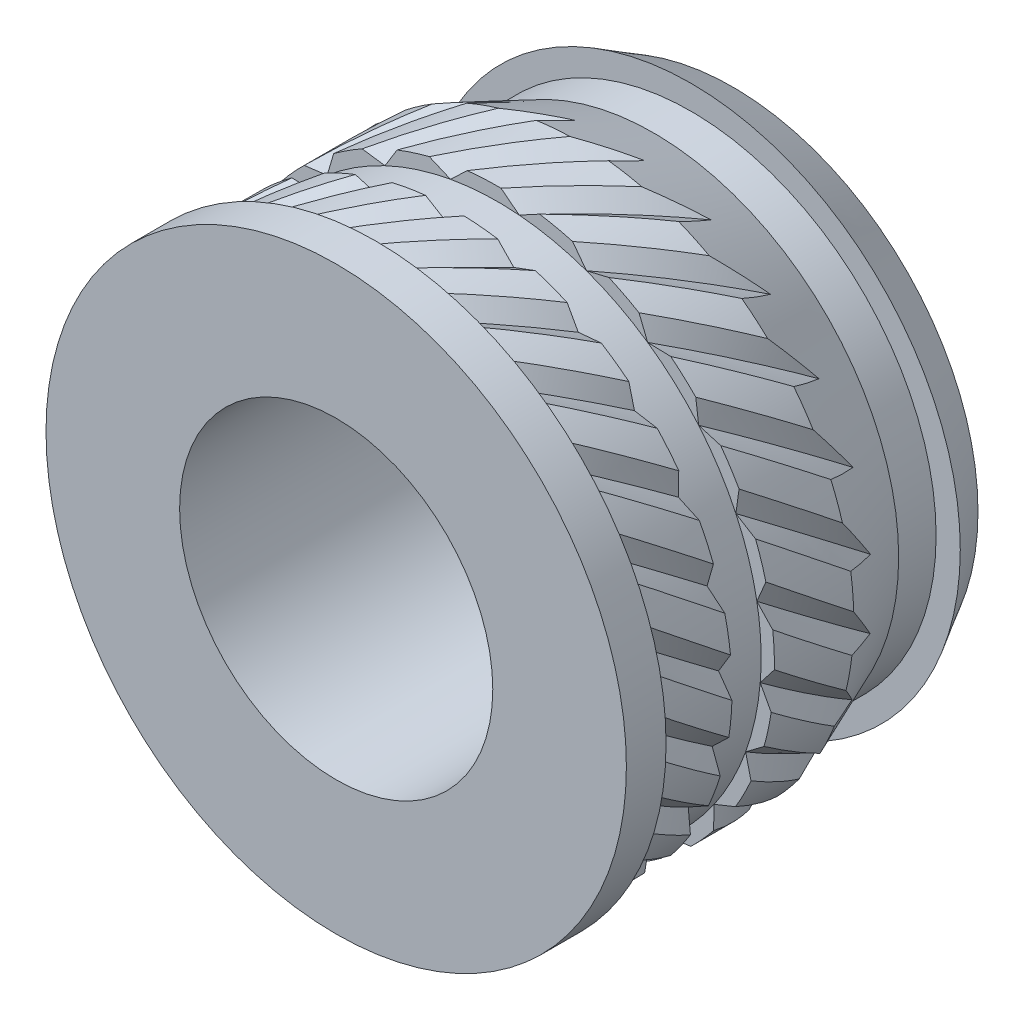
from build123d import *

# Parameters (mm, degrees)
CUT_SWEEP1_PITCH  = 21.28
CIRPATTERN1_COUNT = 24


with BuildPart() as part:
    # Sketch3 → Revolve1 (revolve)
    with BuildSketch(Plane(origin=(0, 0, 0), x_dir=(0, 0, -1), z_dir=(1, 0, 0)), mode=Mode.PRIVATE) as revolve1_sk:
        Polygon((-1.9, 1.5), (-1.9, 2.78), (-1.52, 2.78), (-1.52, 2.6525), (-0.76, 2.6525), (-0.76, 2.525), (-0.354524476, 2.525), (-0.354524476, 2.6525), (0.405475524, 2.6525), (1.14, 2.34825), (1.498597225, 2.34825), (1.498597225, 2.58), (1.9, 2.34825), (1.9, 1.5), align=None)
    revolve(revolve1_sk.sketch.rotate(Axis((0, 0, 1.9), (0, 0, -1)), 90), axis=Axis((0, 0, 1.9), (0, 0, -1)))

    # Cut-Sweep1: the profile of Sketch5 screwed along a right-hand helix of 0.125 turns, 20 arcs to a turn; built about Z, then put on its axis
    cut_sweep1_z = Axis((0, 0, 0), (0, 0, 1))
    cut_sweep1_corners = [(2.655065633, -0.198828403, 0), (2.525, 0, 0), (2.655065633, 0.198828403, 0)]
    with BuildLine(mode=Mode.PRIVATE) as cut_sweep1_profile:
        Line(cut_sweep1_corners[0], cut_sweep1_corners[1])
        Line(cut_sweep1_corners[1], cut_sweep1_corners[2])
        ThreePointArc((2.655065633, 0.198828403, 0), (2.6625, 0, 0), (2.655065633, -0.198828403, 0))
    cut_sweep1_cap = Face(cut_sweep1_profile.wire())
    cut_sweep1_arcs = [((2.655065633, 0.198828403, 0), (2.669955184, 0, 0), (2.655065633, -0.198828403, 0), (1, 0.9972077495400257, 1))]  # start, shoulder, end, weights
    cut_sweep1_turn_angles = [0, 9, 18, 27, 36, 40.5, 45]
    cut_sweep1_turn_weights = [1, 0.9876883405951378, 1, 0.9876883405951378, 1, 0.996917333733128, 1]
    cut_sweep1_turn_rails = [Edge.make_bspline([Vector(p[0], p[1], 0).rotate(cut_sweep1_z, cut_sweep1_turn_angles[k]) / cut_sweep1_turn_weights[k] + Vector(0, 0, p[2] + CUT_SWEEP1_PITCH * cut_sweep1_turn_angles[k] / 360) for k in range(7)], [0, 0, 0, 1, 1, 2, 2, 3, 3, 3], 2, cut_sweep1_turn_weights) for p in cut_sweep1_corners]
    cut_sweep1_turn_sides = [*[Face.make_surface_from_curves(cut_sweep1_turn_rails[p[0]], cut_sweep1_turn_rails[p[1]]) for p in [(0, 1), (1, 2)]], *[Face.make_bezier_surface([[Vector(p[j][0], p[j][1], 0).rotate(cut_sweep1_z, cut_sweep1_turn_angles[2 * i + k]) / cut_sweep1_turn_weights[2 * i + k] + Vector(0, 0, p[j][2] + CUT_SWEEP1_PITCH * cut_sweep1_turn_angles[2 * i + k] / 360) for k in range(3)] for j in range(3)], [[p[3][j] * cut_sweep1_turn_weights[2 * i + k] for k in range(3)] for j in range(3)]) for p in cut_sweep1_arcs for i in range(3)]]
    cut_sweep1 = Plane(origin=(0, 0, 1.52), x_dir=(0, 1, 0), z_dir=(0, 0, -1)) * Solid(Shell([*cut_sweep1_turn_sides, cut_sweep1_cap, cut_sweep1_cap.rotate(cut_sweep1_z, 45).moved(Location((0, 0, CUT_SWEEP1_PITCH * 45 / 360)))]))
    add(cut_sweep1, mode=Mode.SUBTRACT)

    # CirPattern1: Cut-Sweep1 ×24 about axis
    cirpattern1_axis = Axis((0, 0, 1.9), (0, 0, -1))
    for i in range(1, CIRPATTERN1_COUNT):
        add(cut_sweep1.rotate(cirpattern1_axis, i * 360 / CIRPATTERN1_COUNT), mode=Mode.SUBTRACT)


solid = part.part
